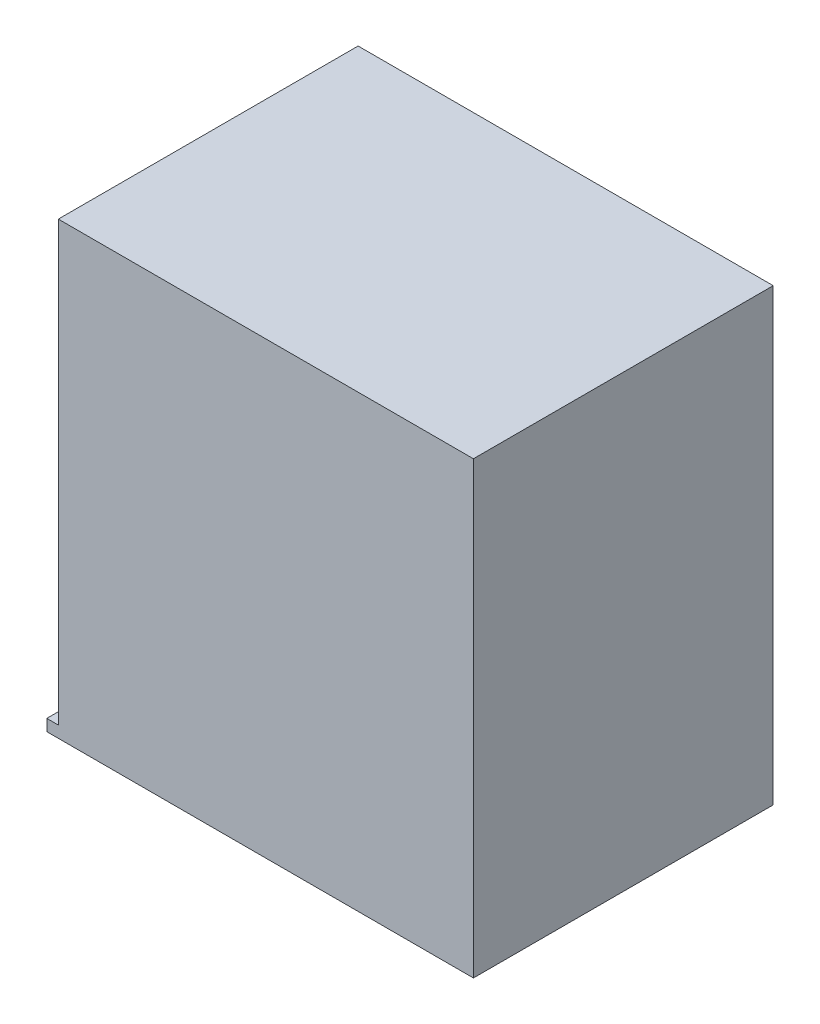
from build123d import *

# Parameters (mm, degrees)
SKIZZE1_W                       = 70
SKIZZE1_H                       = 74
AUFSATZ_LINEAR_AUSTRAGEN1_DEPTH = 2
SKIZZE2_W                       = 52
SKIZZE2_H                       = 74
AUFSATZ_LINEAR_AUSTRAGEN2_DEPTH = 2
SKIZZE3_W                       = 74
SKIZZE3_H                       = 52
AUFSATZ_LINEAR_AUSTRAGEN3_DEPTH = 2
SKIZZE9_W                       = 72
SKIZZE9_H                       = 52
AUFSATZ_LINEAR_AUSTRAGEN7_DEPTH = 2


with BuildPart() as part:
    # Skizze1 → Aufsatz-Linear austragen1 (new body)
    with BuildSketch(Plane.XY):
        with Locations((-44.446663724, -32.790378007)):
            Rectangle(SKIZZE1_W, SKIZZE1_H)
    extrude(amount=AUFSATZ_LINEAR_AUSTRAGEN1_DEPTH)

    # Skizze2 → Aufsatz-Linear austragen2 (add)
    with BuildSketch(Plane(origin=(-9.446663724, 0, 0), x_dir=(0, 0, -1), z_dir=(1, 0, 0))):
        with Locations((24, -32.790378007)):
            Rectangle(SKIZZE2_W, SKIZZE2_H)
    extrude(amount=AUFSATZ_LINEAR_AUSTRAGEN2_DEPTH)

    # Skizze3 → Aufsatz-Linear austragen3 (add)
    with BuildSketch(Plane.XZ.offset(69.790378007)):
        with Locations((-44.446663724, -24)):
            Rectangle(SKIZZE3_W, SKIZZE3_H)
    extrude(amount=AUFSATZ_LINEAR_AUSTRAGEN3_DEPTH)

    # Skizze9 → Aufsatz-Linear austragen7 (add)
    with BuildSketch(Plane(origin=(0, 4.209621993, 0), x_dir=(1, 0, 0), z_dir=(0, 1, 0))):
        with Locations((-43.446663724, 24)):
            Rectangle(SKIZZE9_W, SKIZZE9_H)
    extrude(amount=AUFSATZ_LINEAR_AUSTRAGEN7_DEPTH)


solid = part.part
